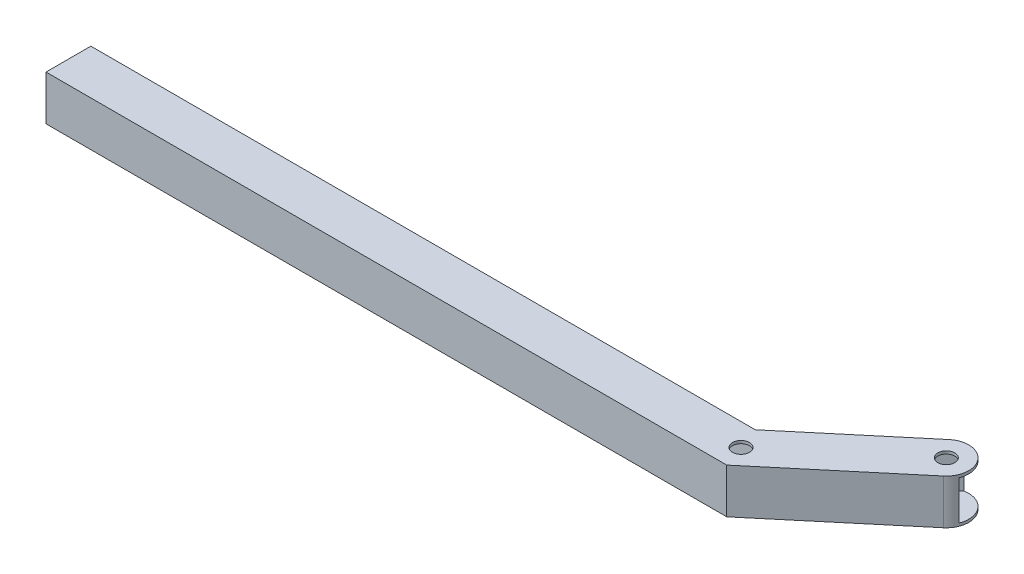
from build123d import *

# Parameters (mm, degrees)
BOSS_EXTRUDE5_DEPTH = 1.5875
BOSS_EXTRUDE6_DEPTH = 22.225
BOSS_EXTRUDE7_DEPTH = 22.225
BOSS_EXTRUDE8_DEPTH = 1.5875
HOLE1_OUTLINE_R     = 4.826
HOLE1_DEPTH         = 25.4
HOLE2_OUTLINE_R     = 4.826
HOLE2_DEPTH         = 25.4


# Read off the part's stored shape, not the designer's step: Hole1, Hole2
with BuildPart() as part:
    # Sketch9 → Boss-Extrude5 (new body)
    with BuildSketch(Plane(origin=(0, 0, 0), x_dir=(1, 0, 0), z_dir=(0, 1, 0))):
        with BuildLine():
            Line((322.629578317, 36.567646265), (382.325566472, 86.658527908))
            ThreePointArc((382.325566472, 86.658527908), (400.217733608, 85.093166118), (398.652371818, 67.200998981))
            Line((398.652371818, 67.200998981), (331.874422413, 11.167646265))
            Line((331.874422413, 11.167646265), (-53.747999635, 11.167646265))
            Line((-53.747999635, 11.167646265), (-53.747999635, 36.567646265))
            Line((-53.747999635, 36.567646265), (322.629578317, 36.567646265))
        make_face()
    extrude(amount=BOSS_EXTRUDE5_DEPTH)

    # Sketch11 → Boss-Extrude6 (add)
    with BuildSketch(Plane(origin=(0, 1.5875, 0), x_dir=(1, 0, 0), z_dir=(0, 1, 0))):
        with BuildLine():
            Line((323.207381137, 34.980146265), (-53.747999635, 34.980146265))
            Line((-53.747999635, 34.980146265), (-53.747999635, 36.567646265))
            Line((-53.747999635, 36.567646265), (322.62957839, 36.567646265))
            Line((322.62957839, 36.567646265), (382.325566502, 86.658527872))
            ThreePointArc((382.325566502, 86.658527872), (385.016979631, 88.390449757), (388.055909658, 89.394522629))
            Line((388.055909658, 89.394522629), (323.207381137, 34.980146265))
        make_face()
    extrude(amount=BOSS_EXTRUDE6_DEPTH)

    # Sketch12 → Boss-Extrude7 (add)
    with BuildSketch(Plane(origin=(0, 1.5875, 0), x_dir=(1, 0, 0), z_dir=(0, 1, 0))):
        with BuildLine():
            Line((331.874422341, 13.239980337), (402.341864283, 72.369184881))
            ThreePointArc((402.341864283, 72.369184881), (400.825340873, 69.550778454), (398.652371788, 67.200999017))
            Line((398.652371788, 67.200999017), (331.874422341, 11.167646265))
            Line((331.874422341, 11.167646265), (-53.747999635, 11.167646265))
            Line((-53.747999635, 11.167646265), (-53.747999635, 12.755146265))
            Line((-53.747999635, 12.755146265), (330.542351676, 12.755146265))
            Line((330.542351676, 12.755146265), (330.85399701, 12.383741818))
            Line((330.85399701, 12.383741818), (331.296619594, 12.755146265))
            Line((331.296619594, 12.755146265), (331.874422341, 12.755146265))
            Line((331.874422341, 12.755146265), (331.874422341, 13.239980337))
        make_face()
    extrude(amount=BOSS_EXTRUDE7_DEPTH)

    # Sketch13 → Boss-Extrude8 (add)
    with BuildSketch(Plane(origin=(0, 23.8125, 0), x_dir=(1, 0, 0), z_dir=(0, 1, 0))):
        with BuildLine():
            Line((322.629578317, 36.567646265), (382.325566472, 86.658527908))
            ThreePointArc((382.325566472, 86.658527908), (400.217733608, 85.093166118), (398.652371818, 67.200998981))
            Line((398.652371818, 67.200998981), (331.874422413, 11.167646265))
            Line((331.874422413, 11.167646265), (-53.747999635, 11.167646265))
            Line((-53.747999635, 11.167646265), (-53.747999635, 36.567646265))
            Line((-53.747999635, 36.567646265), (322.629578317, 36.567646265))
        make_face()
    extrude(amount=BOSS_EXTRUDE8_DEPTH)

    # Hole1 outline → Hole1 (cut)
    with BuildSketch(Plane(origin=(0, 0, 0), x_dir=(1, 0, 0), z_dir=(0, 1, 0))):
        with Locations((327.252000365, 23.867646265)):
            Circle(HOLE1_OUTLINE_R)
    extrude(amount=HOLE1_DEPTH, mode=Mode.SUBTRACT)

    # Hole2 outline → Hole2 (cut)
    with BuildSketch(Plane(origin=(0, 0, 0), x_dir=(1, 0, 0), z_dir=(0, 1, 0))):
        with Locations((390.488969145, 76.929763445)):
            Circle(HOLE2_OUTLINE_R)
    extrude(amount=HOLE2_DEPTH, mode=Mode.SUBTRACT)


solid = part.part
